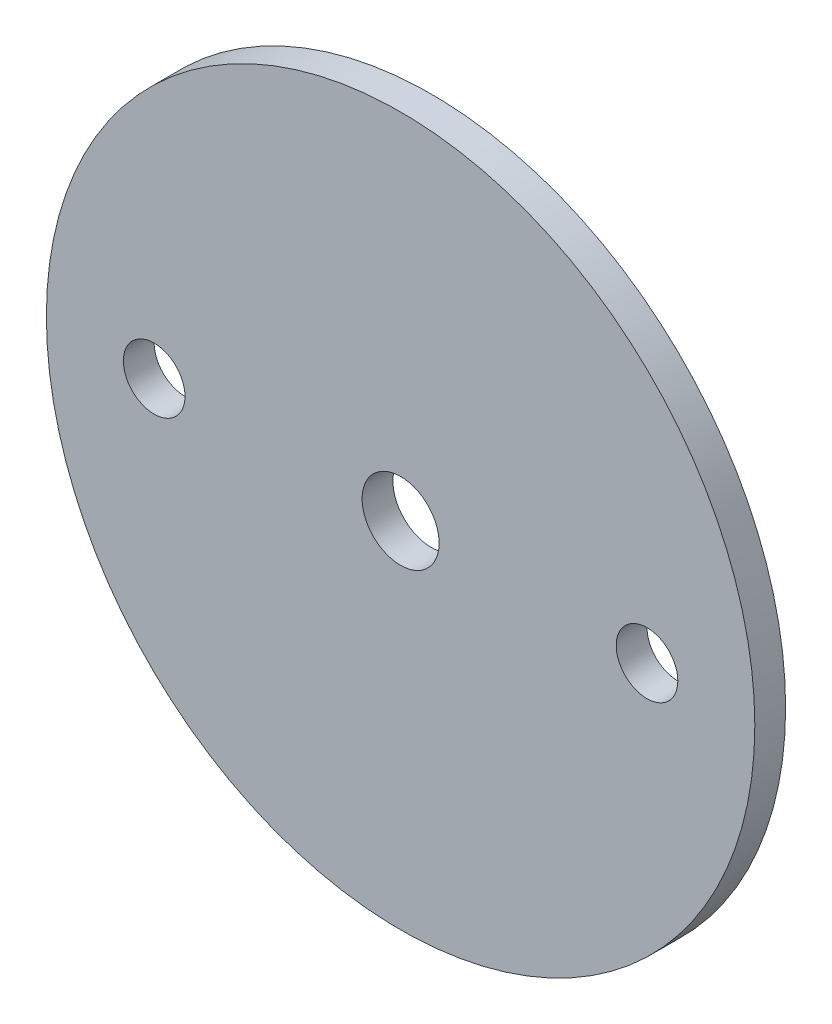
from build123d import *

# Parameters (mm, degrees)
SKETCH1_R                          = 36.5125
BOSS_EXTRUDE1_DEPTH                = 1.5875
F_1_4_0_25_DIAMETER_HOLE1_D        = 6.35
F_5_16_0_3125_DIAMETER_HOLE1_D     = 7.9375
F_5_16_0_3125_DIAMETER_HOLE1_DEPTH = 3.302


with BuildPart() as part:
    # Sketch1 → Boss-Extrude1 (new, symmetric)
    with BuildSketch(Plane.XY):
        Circle(SKETCH1_R)
    extrude(amount=BOSS_EXTRUDE1_DEPTH, both=True)

    # 1/4 (0.25) Diameter Hole1 (through all)
    with Locations(Plane.XY.offset(1.5875)):
        with Locations((-25.4, 0), (25.4, 0)):
            Hole(F_1_4_0_25_DIAMETER_HOLE1_D / 2)

    # 5/16 (0.3125) Diameter Hole1
    with Locations(Plane.XY.offset(1.5875)):
        with Locations((0, 0)):
            Hole(F_5_16_0_3125_DIAMETER_HOLE1_D / 2, depth=F_5_16_0_3125_DIAMETER_HOLE1_DEPTH)


solid = part.part
